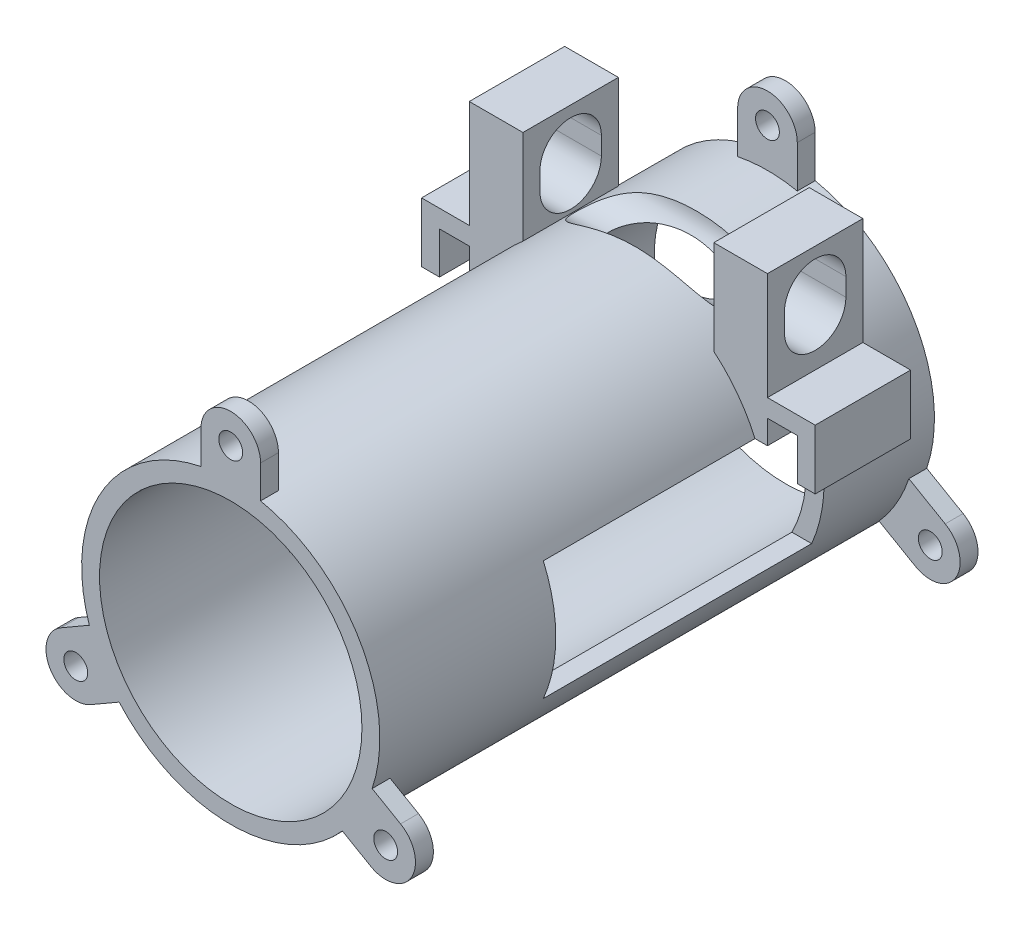
from build123d import *

# Parameters (mm, degrees)
SKETCH1_R           = 25
SKETCH1_R_2         = 22
BOSS_EXTRUDE1_DEPTH = 40
SKETCH3_R           = 5.15
CUT_EXTRUDE1_DEPTH  = 25
BOSS_EXTRUDE2_DEPTH = 8
CUT_EXTRUDE3_DEPTH  = 73.97259772
BOSS_EXTRUDE3_DEPTH = 8
SKETCH7_R           = 25
SKETCH7_R_2         = 22
BOSS_EXTRUDE4_DEPTH = 53
SKETCH8_W           = 45
SKETCH8_H           = 20
CUT_EXTRUDE4_DEPTH  = 50
SKETCH9_R           = 2
BOSS_EXTRUDE5_DEPTH = 3
CIRPATTERN1_COUNT   = 3
BOSS_EXTRUDE6_START = -3
SKETCH10_R          = 2
BOSS_EXTRUDE6_DEPTH = 3
CIRPATTERN2_COUNT   = 3


with BuildPart() as part:
    # Sketch1 → Boss-Extrude1 (new body)
    with BuildSketch(Plane.XY):
        Circle(SKETCH1_R)
        Circle(SKETCH1_R_2, mode=Mode.SUBTRACT)
    extrude(amount=BOSS_EXTRUDE1_DEPTH)

    # Sketch3 → Cut-Extrude1 (cut, symmetric)
    with BuildSketch(Plane(origin=(0, 0, 0), x_dir=(0, 0, -1), z_dir=(1, 0, 0))):
        with Locations((-20, 25)):
            Circle(SKETCH3_R)
    extrude(amount=CUT_EXTRUDE1_DEPTH, both=True, mode=Mode.SUBTRACT)

    # Sketch4 → Boss-Extrude2 (add, symmetric)
    with BuildSketch(Plane.XY.offset(20)):
        with BuildLine():
            Line((-16, 19.209372712), (-16, 35))
            Line((-16, 35), (-25, 35))
            Line((-25, 35), (-25, 0))
            ThreePointArc((-25, 0), (-22.638462845, 10.606601718), (-16, 19.209372712))
        make_face()
    boss_extrude2 = extrude(amount=BOSS_EXTRUDE2_DEPTH, both=True)

    # Sketch5 → Cut-Extrude3 (cut, through all)
    with BuildSketch(Plane.ZY.offset(25)):
        with BuildLine():
            Line((14.85, 25), (14.85, 28))
            ThreePointArc((14.85, 28), (20, 33.15), (25.15, 28))
            Line((25.15, 28), (25.15, 25))
            ThreePointArc((25.15, 25), (20, 19.85), (14.85, 25))
        make_face()
    cut_extrude3 = extrude(amount=-CUT_EXTRUDE3_DEPTH, mode=Mode.SUBTRACT)

    # Sketch6 → Boss-Extrude3 (add, symmetric)
    with BuildSketch(Plane.XY.offset(20)):
        Polygon((-30, 14), (-25, 14), (-25, 17), (-33, 17), (-33, 7), (-30, 7), align=None)
    boss_extrude3 = extrude(amount=BOSS_EXTRUDE3_DEPTH, both=True)

    # Mirror1: Boss-Extrude2, Cut-Extrude3, Boss-Extrude3 across plane
    add(boss_extrude2.mirror(Plane(origin=(0, 0, 0), x_dir=(0, 0, 1), z_dir=(1, 0, 0))))
    add(cut_extrude3.mirror(Plane(origin=(0, 0, 0), x_dir=(0, 0, 1), z_dir=(1, 0, 0))), mode=Mode.SUBTRACT)
    add(boss_extrude3.mirror(Plane(origin=(0, 0, 0), x_dir=(0, 0, 1), z_dir=(1, 0, 0))))

    # Sketch7 → Boss-Extrude4 (add)
    with BuildSketch(Plane.XY.offset(40)):
        Circle(SKETCH7_R)
        Circle(SKETCH7_R_2, mode=Mode.SUBTRACT)
    extrude(amount=BOSS_EXTRUDE4_DEPTH)

    # Sketch8 → Cut-Extrude4 (cut)
    with BuildSketch(Plane.ZY.offset(25)):
        with Locations((41, 0)):
            Rectangle(SKETCH8_W, SKETCH8_H)
    extrude(amount=-CUT_EXTRUDE4_DEPTH, mode=Mode.SUBTRACT)

    # Sketch9 → Boss-Extrude5 (add)
    with BuildSketch(Plane(origin=(0, 0, 0), x_dir=(-1, 0, 0), z_dir=(0, 0, -1))):
        with BuildLine():
            Line((5, 24.494897428), (5, 31.532998323))
            ThreePointArc((5, 31.532998323), (0, 36.532998323), (-5, 31.532998323))
            Line((-5, 31.532998323), (-5, 24.494897428))
            ThreePointArc((-5, 24.494897428), (0, 25), (5, 24.494897428))
        make_face()
        with Locations((0, 31.532998323)):
            Circle(SKETCH9_R, mode=Mode.SUBTRACT)
    boss_extrude5 = extrude(amount=-BOSS_EXTRUDE5_DEPTH)

    # CirPattern1: Boss-Extrude5 ×3 about axis
    cirpattern1_axis = Axis((0, 0, 0), (0, 0, 1))
    for i in range(1, CIRPATTERN1_COUNT):
        add(boss_extrude5.rotate(cirpattern1_axis, i * 360 / CIRPATTERN1_COUNT))

    # Sketch10 → Boss-Extrude6 (add)
    with BuildSketch(Plane.XY.offset(93).offset(BOSS_EXTRUDE6_START)):
        with BuildLine():
            ThreePointArc((-5, 24.494897428), (0, 25), (5, 24.494897428))
            Line((5, 24.494897428), (5, 30))
            ThreePointArc((5, 30), (0, 35), (-5, 30))
            Line((-5, 30), (-5, 24.494897428))
        make_face()
        with Locations((0, 30)):
            Circle(SKETCH10_R, mode=Mode.SUBTRACT)
    boss_extrude6 = extrude(amount=BOSS_EXTRUDE6_DEPTH)

    # CirPattern2: Boss-Extrude6 ×3 about axis
    cirpattern2_axis = Axis((0, 0, 93), (0, 0, 1))
    for i in range(1, CIRPATTERN2_COUNT):
        add(boss_extrude6.rotate(cirpattern2_axis, i * 360 / CIRPATTERN2_COUNT))


solid = part.part
